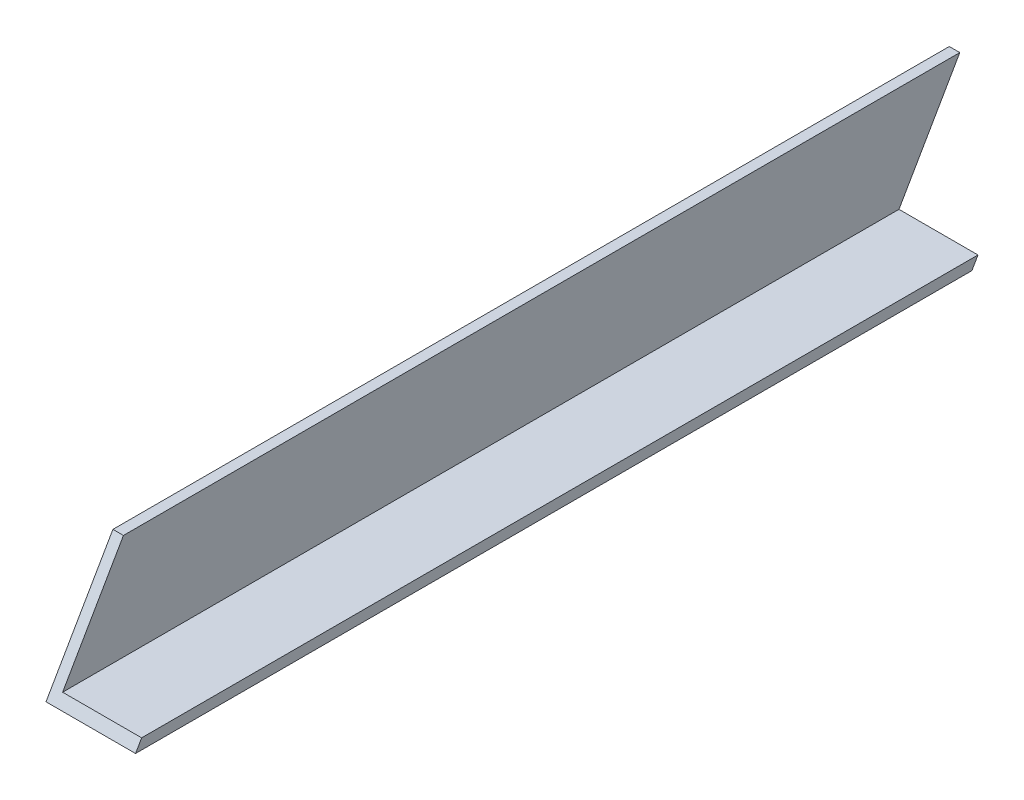
from build123d import *

# Parameters (mm, degrees)
BOSS_EXTRUDE1_DEPTH     = 200
CUT_EXTRUDE1_DEPTH      = 202.764714457
CUT_EXTRUDE1_DEPTH_BACK = 202.764714457


with BuildPart() as part:
    # Sketch1 → Boss-Extrude1 (new body)
    with BuildSketch(Plane.XY):
        Polygon((0, 0), (0, 22), (2, 22), (2, 2), (17, 2), (17, 0), align=None)
    extrude(amount=BOSS_EXTRUDE1_DEPTH)

    # Sketch2 → Cut-Extrude1 (cut, two sides: drawn at the far end of the back side and taken through both)
    with BuildSketch(Plane(origin=(2, 0, 0), x_dir=(0, 0, -1), z_dir=(1, 0, 0)).offset(-CUT_EXTRUDE1_DEPTH_BACK)):
        Polygon((-200, 22), (-200, 0), (-187.298294078, 22), align=None)
        Polygon((0, 22), (-28.526970051, 22), (-41.228675973, 0), (0, 0), align=None)
    extrude(amount=CUT_EXTRUDE1_DEPTH + CUT_EXTRUDE1_DEPTH_BACK, mode=Mode.SUBTRACT)


solid = part.part
